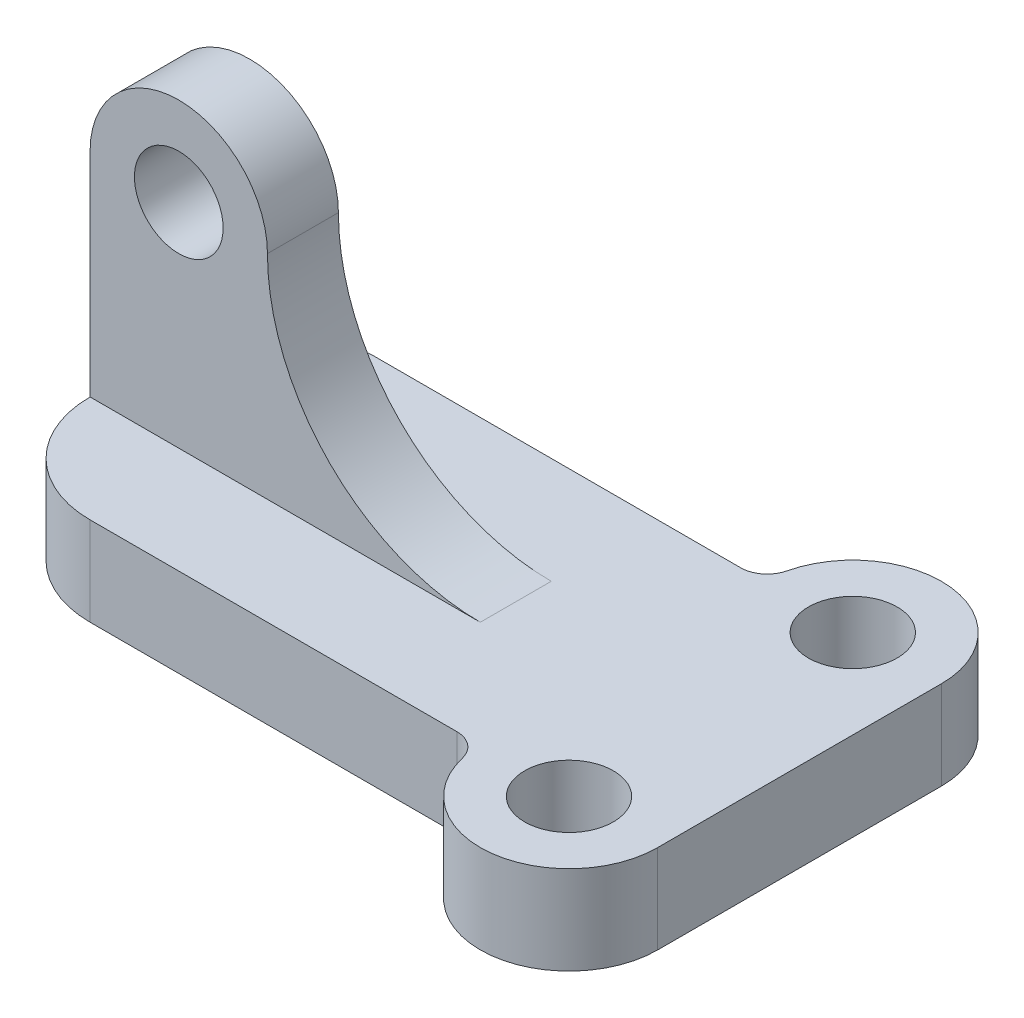
from build123d import *

# Parameters (mm, degrees)
BOSS_EXTRUDE1_DEPTH = 10
FILLET1_R           = 3
FILLET2_R           = 3
FILLET3_R           = 12
FILLET4_R           = 12
SKETCH2_R           = 5
BOSS_EXTRUDE2_DEPTH = 4
FILLET5_R           = 24


with BuildPart() as part:
    # Sketch1 → Boss-Extrude1 (new body)
    with BuildSketch(Plane(origin=(0, 0, 0), x_dir=(1, 0, 0), z_dir=(0, 1, 0))):
        with BuildLine():
            Line((56, 32), (0, 32))
            Line((0, 32), (0, 0))
            Line((0, 0), (56, 0))
            ThreePointArc((56, 0), (66, -10), (76, 0))
            Line((76, 0), (76, 32))
            ThreePointArc((76, 32), (66, 42), (56, 32))
        make_face()
        with BuildLine():
            ThreePointArc((71, 0), (66, -5), (61, 0))
            ThreePointArc((61, 0), (66, 5), (71, 0))
        make_face(mode=Mode.SUBTRACT)
        with BuildLine():
            ThreePointArc((71, 32), (66, 27), (61, 32))
            ThreePointArc((61, 32), (66, 37), (71, 32))
        make_face(mode=Mode.SUBTRACT)
    extrude(amount=BOSS_EXTRUDE1_DEPTH)

    # Fillet1
    fillet1_edges = [part.edges().sort_by_distance(p)[0] for p in [
        (56, 5, 0),
    ]]
    fillet(fillet1_edges, radius=FILLET1_R)

    # Fillet2
    fillet2_edges = [part.edges().sort_by_distance(p)[0] for p in [
        (56, 5, -32),
    ]]
    fillet(fillet2_edges, radius=FILLET2_R)

    # Fillet3
    fillet3_edges = [part.edges().sort_by_distance(p)[0] for p in [
        (0, 5, -32),
    ]]
    fillet(fillet3_edges, radius=FILLET3_R)

    # Fillet4
    fillet4_edges = [part.edges().sort_by_distance(p)[0] for p in [
        (0, 5, 0),
    ]]
    fillet(fillet4_edges, radius=FILLET4_R)

    # Sketch2 → Boss-Extrude2 (add, symmetric)
    with BuildSketch(Plane.XY.offset(-16)):
        with BuildLine():
            Line((0, 10), (0, 34))
            ThreePointArc((0, 34), (10, 44), (20, 34))
            Line((20, 34), (20, 10))
            Line((20, 10), (0, 10))
        make_face()
        with Locations((10, 34)):
            Circle(SKETCH2_R, mode=Mode.SUBTRACT)
    extrude(amount=BOSS_EXTRUDE2_DEPTH, both=True)

    # Fillet5
    fillet5_edges = [part.edges().sort_by_distance(p)[0] for p in [
        (20, 10, -16),
    ]]
    fillet(fillet5_edges, radius=FILLET5_R - 0.0001)  # a hair under: the kernel refuses the full size


solid = part.part
